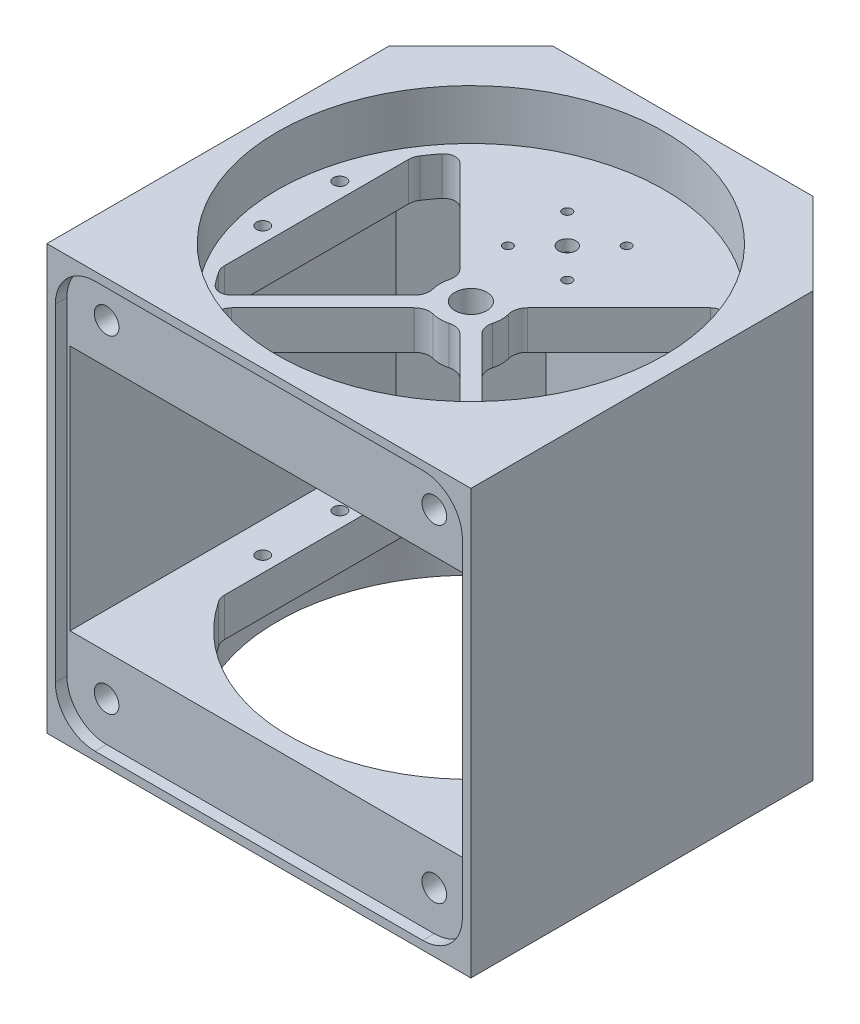
from build123d import *

# Parameters (mm, degrees)
BOSS_EXTRUDE1_DEPTH  = 3
BOSS_EXTRUDE2_REACH  = 125.02
SKETCH3_R            = 50.2
BOSS_EXTRUDE3_DEPTH  = 3
SKETCH4_R            = 50.2
BOSS_EXTRUDE5_DEPTH  = 10
SKETCH5_R            = 47.199999999999996
BOSS_EXTRUDE6_DEPTH  = 2
BOSS_EXTRUDE14_DEPTH = 20
SKETCH12_R           = 47.2
BOSS_EXTRUDE16_DEPTH = 8
SKETCH13_R           = 3.2000000000000037
CUT_EXTRUDE2_DEPTH   = 15
SKETCH14_R           = 4.15
BOSS_EXTRUDE17_DEPTH = 10
FILLET1_R            = 3
FILLET2_R            = 4
SKETCH15_R           = 1.6500000000000017
BOSS_EXTRUDE18_DEPTH = 10
FILLET3_R            = 4
FILLET4_R            = 3
FILLET5_R            = 4
FILLET6_R            = 4
BOSS_EXTRUDE19_DEPTH = 5
SKETCH17_R           = 2.2500000000000004
SKETCH17_R_2         = 1.2000000000000048
SKETCH17_R_3         = 1.200000000000003
CUT_EXTRUDE3_DEPTH   = 154.58710883404248
SKETCH18_R           = 8.2
CUT_EXTRUDE4_DEPTH   = 2
CUT_EXTRUDE5_DEPTH   = 10


with BuildPart() as part:
    # Sketch1 → Boss-Extrude1 (new body)
    with BuildSketch(Plane.XY):
        Polygon((54.99999999999996, 55), (-55.00000000000002, 54.99999999999997), (-55.00000000000001, -55.00000000000003), (54.99999999999999, -55), align=None)
        with BuildLine():
            Line((52.79999999999999, -42.500000000000014), (52.800000000000004, 42.49999999999998))
            ThreePointArc((52.800000000000004, 42.49999999999998), (49.78319984622145, 49.78319984622142), (42.50000000000001, 52.79999999999998))
            Line((42.50000000000001, 52.79999999999998), (-42.499999999999986, 52.79999999999999))
            ThreePointArc((-42.499999999999986, 52.79999999999999), (-49.78319984622143, 49.78319984622143), (-52.79999999999999, 42.499999999999986))
            Line((-52.79999999999999, 42.499999999999986), (-52.800000000000004, -42.5))
            ThreePointArc((-52.800000000000004, -42.5), (-49.78319984622144, -49.783199846221436), (-42.5, -52.8))
            Line((-42.5, -52.8), (42.499999999999986, -52.80000000000001))
            ThreePointArc((42.499999999999986, -52.80000000000001), (49.78319984622143, -49.78319984622145), (52.79999999999999, -42.500000000000014))
        make_face(mode=Mode.SUBTRACT)
    extrude(amount=-BOSS_EXTRUDE1_DEPTH)

    # Boss-Extrude2: up to this face of the body (flat: up to its plane)
    boss_extrude2_end = Plane(part.part.faces().sort_by_distance((0, 55, -1.5))[0])
    # Sketch2 → Boss-Extrude2 (add, up to the picked face)
    with BuildSketch(Plane.XZ.offset(55.000000000000014), mode=Mode.PRIVATE) as boss_extrude2_sk1:
        Polygon((54.99999999999998, -3), (54.99999999999999, -88.78679656440359), (33.786796564403566, -110), (-33.78679656440356, -110), (-55.00000000000002, -88.78679656440362), (-55.00000000000002, -3), (-52.00000000000002, -3.0000000000000027), (-52.00000000000002, -87.54415587728425), (-32.54415587728427, -107), (32.5441558772843, -107), (51.99999999999998, -87.54415587728431), (51.99999999999998, -3), align=None)
    boss_extrude2_tool1 = split(extrude(boss_extrude2_sk1.sketch, amount=-BOSS_EXTRUDE2_REACH, mode=Mode.PRIVATE), bisect_by=boss_extrude2_end, keep=Keep.BOTH, mode=Mode.PRIVATE)
    add(boss_extrude2_tool1.solids().sort_by(Axis((53.465432, -55, -45.893398), (-2.5e-16, 1, 0)))[0])

    # Sketch3 → Boss-Extrude3 (add)
    with BuildSketch(Plane.XZ.offset(55.000000000000014)):
        Polygon((-52.00000000000002, -3.0000000000000027), (-52.00000000000002, -87.54415587728425), (-32.54415587728427, -107), (32.5441558772843, -107), (51.99999999999998, -87.54415587728431), (51.99999999999998, -3), align=None)
        with Locations((0, -55)):
            Circle(SKETCH3_R, mode=Mode.SUBTRACT)
    boss_extrude3 = extrude(amount=-BOSS_EXTRUDE3_DEPTH)

    # Sketch4 → Boss-Extrude5 (add)
    with BuildSketch(Plane(origin=(1.388e-14, -52.000000000000014, 0), x_dir=(1, 2.7e-16, 0), z_dir=(-2.7e-16, 1, 0))):
        with BuildLine():
            Line((11.235657524150534, 3.000000000000002), (-11.235657524150536, 3.0000000000000027))
            ThreePointArc((-11.235657524150536, 3.0000000000000027), (1.431e-14, 108.2), (11.235657524150534, 3.000000000000002))
        make_face()
        with Locations((-7.6e-16, 55)):
            Circle(SKETCH4_R, mode=Mode.SUBTRACT)
    boss_extrude5 = extrude(amount=BOSS_EXTRUDE5_DEPTH)

    # Sketch5 → Boss-Extrude6 (add)
    with BuildSketch(Plane(origin=(1.121e-14, -42.00000000000001, 0), x_dir=(1, 2.7e-16, 0), z_dir=(-2.7e-16, 1, 0))):
        with BuildLine():
            Line((51.99999999999997, 43.76434247584933), (51.99999999999997, 66.23565752415067))
            ThreePointArc((51.99999999999997, 66.23565752415067), (37.61808075912428, 92.61808075912438), (11.235657524150533, 107.00000000000001))
            Line((11.235657524150533, 107.00000000000001), (-11.235657524150534, 107))
            ThreePointArc((-11.235657524150534, 107), (-37.618080759124375, 92.61808075912428), (-52.00000000000003, 66.23565752415041))
            Line((-52.00000000000003, 66.23565752415041), (-52.00000000000003, 43.7643424758496))
            ThreePointArc((-52.00000000000003, 43.7643424758496), (-37.618080759124375, 17.381919240875717), (-11.235657524150529, 2.9999999999999956))
            Line((-11.235657524150529, 2.9999999999999956), (11.23565752415051, 2.9999999999999956))
            ThreePointArc((11.23565752415051, 2.9999999999999956), (37.618080759124275, 17.38191924087561), (51.99999999999997, 43.76434247584933))
        make_face()
        with Locations(Location((-7.6e-16, 55, 0), (0, 0, 180))):
            Circle(SKETCH5_R, mode=Mode.SUBTRACT)
    boss_extrude6 = extrude(amount=BOSS_EXTRUDE6_DEPTH)

    # Sketch11 → Boss-Extrude14 (add)
    with BuildSketch(Plane(origin=(1.388e-14, -52.000000000000014, 0), x_dir=(1, 2.7e-16, 0), z_dir=(-2.7e-16, 1, 0))):
        with BuildLine():
            Line((-52.00000000000002, 43.76434247584956), (-52.00000000000002, 3.0000000000000027))
            Line((-52.00000000000002, 3.0000000000000027), (-46.47994974842644, 3.000000000000002))
            Line((-46.47994974842644, 3.000000000000002), (-11.235657524150511, 3.0000000000000018))
            ThreePointArc((-11.235657524150511, 3.0000000000000018), (-37.61808075912436, 17.381919240875703), (-52.00000000000002, 43.76434247584956))
        make_face()
        with BuildLine():
            Line((-11.235657524150536, 107), (-32.54415587728427, 107))
            Line((-32.54415587728427, 107), (-52.00000000000003, 87.54415587728425))
            Line((-52.00000000000003, 87.54415587728425), (-52.00000000000002, 66.23565752415044))
            ThreePointArc((-52.00000000000002, 66.23565752415044), (-37.61808075912436, 92.6180807591243), (-11.235657524150536, 107))
        make_face()
        with BuildLine():
            Line((51.99999999999998, 66.23565752415062), (51.99999999999998, 87.54415587728431))
            Line((51.99999999999998, 87.54415587728431), (32.5441558772843, 107))
            Line((32.5441558772843, 107), (11.235657524150536, 107))
            ThreePointArc((11.235657524150536, 107), (37.6180807591243, 92.61808075912435), (51.99999999999998, 66.23565752415062))
        make_face()
        with BuildLine():
            Line((11.235657524150534, 3.000000000000002), (46.47994974842649, 3.0000000000000004))
            Line((46.47994974842649, 3.0000000000000004), (51.99999999999998, 3))
            Line((51.99999999999998, 3), (51.99999999999998, 43.764342475849375))
            ThreePointArc((51.99999999999998, 43.764342475849375), (37.6180807591243, 17.38191924087564), (11.235657524150534, 3.000000000000002))
        make_face()
    boss_extrude14 = extrude(amount=BOSS_EXTRUDE14_DEPTH)

    # Sketch12 → Boss-Extrude16 (add)
    with BuildSketch(Plane(origin=(1.068e-14, -40.00000000000001, 0), x_dir=(1, 2.7e-16, 0), z_dir=(-2.7e-16, 1, 0))):
        with BuildLine():
            Line((51.99999999999997, 43.764342475849375), (51.99999999999997, 66.23565752415062))
            ThreePointArc((51.99999999999997, 66.23565752415062), (37.618080759124304, 92.61808075912435), (11.23565752415058, 106.99999999999999))
            Line((11.23565752415058, 106.99999999999999), (-11.235657524150536, 107))
            ThreePointArc((-11.235657524150536, 107), (-37.61808075912436, 92.6180807591243), (-52.00000000000003, 66.23565752415044))
            Line((-52.00000000000003, 66.23565752415044), (-52.00000000000003, 43.76434247584956))
            ThreePointArc((-52.00000000000003, 43.76434247584956), (-37.61808075912437, 17.381919240875696), (-11.235657524150529, 2.999999999999989))
            Line((-11.235657524150529, 2.999999999999989), (11.235657524150508, 3.0000000000000027))
            ThreePointArc((11.235657524150508, 3.0000000000000027), (37.61808075912429, 17.38191924087564), (51.99999999999997, 43.764342475849375))
        make_face()
        with Locations(Location((-7.6e-16, 55, 0), (0, 0, 180))):
            Circle(SKETCH12_R, mode=Mode.SUBTRACT)
    boss_extrude16 = extrude(amount=BOSS_EXTRUDE16_DEPTH)

    # Mirror2: Boss-Extrude3, Boss-Extrude5, Boss-Extrude6, Boss-Extrude14, Boss-Extrude16 across plane
    add(boss_extrude3.mirror(Plane.ZX))
    add(boss_extrude5.mirror(Plane.ZX))
    add(boss_extrude6.mirror(Plane.ZX))
    add(boss_extrude14.mirror(Plane.ZX))
    add(boss_extrude16.mirror(Plane.ZX))

    # Sketch13 → Cut-Extrude2 (cut)
    with BuildSketch(Plane.XY.offset(-3.000000000000048)):
        with Locations((-42.499999999999986, 42.5)):
            Circle(SKETCH13_R)
        with Locations((-42.499999999999986, -42.499999999999986)):
            Circle(SKETCH13_R)
        with Locations((42.49999999999999, -42.5)):
            Circle(SKETCH13_R)
        with Locations((42.50000000000001, 42.499999999999986)):
            Circle(SKETCH13_R)
    extrude(amount=-CUT_EXTRUDE2_DEPTH, mode=Mode.SUBTRACT)

    # Sketch14 → Boss-Extrude17 (add)
    with BuildSketch(Plane(origin=(1.121e-14, 42.00000000000001, 0), x_dir=(1, -2.7e-16, 0), z_dir=(2.7e-16, 1, 0))):
        with BuildLine():
            Line((-34.759678021576725, 86.93125089683014), (-6.891439137424786, 59.06301201267851))
            ThreePointArc((-6.891439137424786, 59.06301201267851), (-7.999999999999999, 54.99999999999995), (-6.891439137424732, 50.936987987321395))
            Line((-6.891439137424732, 50.936987987321395), (-34.759678021576356, 23.06874910316946))
            ThreePointArc((-34.759678021576356, 23.06874910316946), (-33.37544007200486, 21.62455992799478), (-31.93125089683014, 20.240321978423275))
            Line((-31.93125089683014, 20.240321978423275), (-4.063012012678523, 48.108560862575224))
            ThreePointArc((-4.063012012678523, 48.108560862575224), (3.881e-14, 47.00000000000001), (4.06301201267859, 48.10856086257526))
            Line((4.06301201267859, 48.10856086257526), (31.93125089683052, 20.24032197842364))
            ThreePointArc((31.93125089683052, 20.24032197842364), (33.37544007200523, 21.624559927995165), (34.75967802157674, 23.068749103169893))
            Line((34.75967802157674, 23.068749103169893), (6.8914391374247845, 50.936987987321494))
            ThreePointArc((6.8914391374247845, 50.936987987321494), (7.999999999999994, 55.00000000000005), (6.891439137424739, 59.06301201267859))
            Line((6.891439137424739, 59.06301201267859), (34.75967802157636, 86.9312508968305))
            ThreePointArc((34.75967802157636, 86.9312508968305), (33.375440072004835, 88.3754400720052), (31.93125089683011, 89.75967802157672))
            Line((31.93125089683011, 89.75967802157672), (4.063012012678516, 61.89143913742478))
            ThreePointArc((4.063012012678516, 61.89143913742478), (-4.645e-14, 63), (-4.063012012678599, 61.89143913742474))
            Line((-4.063012012678599, 61.89143913742474), (-31.931250896830555, 89.75967802157635))
            ThreePointArc((-31.931250896830555, 89.75967802157635), (-33.375440072005254, 88.37544007200484), (-34.759678021576725, 86.93125089683014))
        make_face()
        with Locations(Location((-7.6e-16, 55, 0), (0, 0, 180))):
            Circle(SKETCH14_R, mode=Mode.SUBTRACT)
    boss_extrude17 = extrude(amount=-BOSS_EXTRUDE17_DEPTH)

    # Fillet1
    # the kernel refuses this fillet: 3 mm, written as the material it adds along each edge
    with BuildSketch(Plane(origin=(-34.759678021576704, 40.000000000000014, -86.93125089683014), x_dir=(-0.6499532804124343, 0, 0.7599741661932433), z_dir=(-2.7e-16, -1, 0))) as fillet1_piece_1:
        with BuildLine():
            CenterArc((3.2430714913870022, -2.998110927308941), FILLET1_R, 87.96659386431453, 96.49532662607197)
            Line((0.25216371595927567, -3.2315004705321977), (0, 0))
            ThreePointArc((0, 0), (1.6747590196221822, 0.02972141033939397), (3.349518039244354, 5e-17))
        make_face()
    extrude(amount=8)
    with BuildSketch(Plane(origin=(-31.931250896830544, 40.000000000000014, -89.75967802157635), x_dir=(0.7599741661932361, 0, -0.6499532804124429), z_dir=(-2.7e-16, -1, 0))) as fillet1_piece_2:
        with BuildLine():
            CenterArc((3.243071491387006, 2.998110927308935), FILLET1_R, 175.53807950961286, 96.49532662607254)
            Line((0.2521637159592789, 3.2315004705322257), (0, 0))
            ThreePointArc((0, 0), (1.674759019622179, -0.02972141033938742), (3.349518039244354, -3e-17))
        make_face()
    extrude(amount=8)
    with BuildSketch(Plane(origin=(31.931250896830118, 40, -89.75967802157672), x_dir=(-0.7599741661932423, 0, -0.6499532804124355), z_dir=(-2.7e-16, -1, 0))) as fillet1_piece_3:
        with BuildLine():
            CenterArc((3.243071491386964, -2.9981109273089364), FILLET1_R, 87.96659386431435, 96.49532662607214)
            Line((0.25216371595923237, -3.2315004705321937), (0, 0))
            ThreePointArc((0, 0), (1.6747590196221533, 0.02972141033940673), (3.3495180392443262, 4e-17))
        make_face()
    extrude(amount=8)
    with BuildSketch(Plane(origin=(34.75967802157638, 40, -86.9312508968305), x_dir=(0.6499532804124455, 0, 0.7599741661932338), z_dir=(-2.7e-16, -1, 0))) as fillet1_piece_4:
        with BuildLine():
            CenterArc((3.243071491386969, 2.9981109273089324), FILLET1_R, 175.53807950961357, 96.49532662607226)
            Line((0.25216371595924175, 3.2315004705321857), (0, 0))
            ThreePointArc((0, 0), (1.6747590196221902, -0.02972141033940014), (3.34951803924434, 1.2e-16))
        make_face()
    extrude(amount=8)
    with BuildSketch(Plane(origin=(34.75967802157676, 40, -23.068749103169893), x_dir=(0.6499532804124305, 0, -0.7599741661932468), z_dir=(-2.7e-16, -1, 0))) as fillet1_piece_5:
        with BuildLine():
            CenterArc((3.243071491386989, -2.9981109273089372), FILLET1_R, 87.96659386431473, 96.49532662607226)
            Line((0.25216371595926346, -3.2315004705322194), (0, 0))
            ThreePointArc((0, 0), (1.6747590196221576, 0.02972141033939562), (3.3495180392443307, 7e-17))
        make_face()
    extrude(amount=8)
    with BuildSketch(Plane(origin=(31.93125089683053, 40, -20.240321978423637), x_dir=(-0.7599741661932353, 0, 0.6499532804124437), z_dir=(-2.7e-16, -1, 0))) as fillet1_piece_6:
        with BuildLine():
            CenterArc((3.2430714913869796, 2.9981109273089372), FILLET1_R, 175.5380795096136, 96.49532662607197)
            Line((0.2521637159592498, 3.2315004705321897), (0, 0))
            ThreePointArc((0, 0), (1.6747590196221802, -0.02972141033940335), (3.349518039244338, -4e-17))
        make_face()
    extrude(amount=8)
    with BuildSketch(Plane(origin=(-31.931250896830132, 40.000000000000014, -20.24032197842327), x_dir=(0.7599741661932465, 0, 0.6499532804124305), z_dir=(-2.7e-16, -1, 0))) as fillet1_piece_7:
        with BuildLine():
            CenterArc((3.2430714913869956, -2.998110927308939), FILLET1_R, 87.96659386431477, 96.49532662607203)
            Line((0.2521637159592676, -3.2315004705322137), (0, 0))
            ThreePointArc((0, 0), (1.6747590196221702, 0.02972141033938877), (3.349518039244335, 1e-17))
        make_face()
    extrude(amount=8)
    with BuildSketch(Plane(origin=(-34.75967802157635, 40.000000000000014, -23.06874910316946), x_dir=(-0.6499532804124424, 0, -0.7599741661932364), z_dir=(-2.7e-16, -1, 0))) as fillet1_piece_8:
        with BuildLine():
            CenterArc((3.24307149138697, 2.9981109273089377), FILLET1_R, 175.53807950961334, 96.49532662607214)
            Line((0.2521637159592439, 3.231500470532203), (0, 0))
            ThreePointArc((0, 0), (1.6747590196221709, -0.02972141033939545), (3.3495180392443236, 3.3e-16))
        make_face()
    extrude(amount=8)
    with BuildSketch(Plane(origin=(-34.75967802157635, 42.000000000000014, -23.06874910316946), x_dir=(-0.64995328041244, 0, -0.7599741661932384), z_dir=(-2.7e-16, -1, 0))) as fillet1_piece_9:
        with BuildLine():
            CenterArc((3.24307149138698, 2.9981109273089377), FILLET1_R, 175.53807950961317, 96.49532662607214)
            Line((0.2521637159592546, 3.2315004705322123), (0, 0))
            ThreePointArc((0, 0), (1.674759019622166, -0.02972141033939515), (3.3495180392443245, -1e-16))
        make_face()
    extrude(amount=2)
    with BuildSketch(Plane(origin=(-31.931250896830132, 42.000000000000014, -20.24032197842327), x_dir=(0.7599741661932475, 0, 0.6499532804124295), z_dir=(-2.7e-16, -1, 0))) as fillet1_piece_10:
        with BuildLine():
            CenterArc((3.2430714913870027, -2.9981109273089372), FILLET1_R, 87.9665938643148, 96.49532662607226)
            Line((0.2521637159592757, -3.2315004705322257), (0, 0))
            ThreePointArc((0, 0), (1.6747590196221758, 0.02972141033938655), (3.349518039244341, 1.9e-16))
        make_face()
    extrude(amount=2)
    with BuildSketch(Plane(origin=(31.93125089683053, 42, -20.240321978423637), x_dir=(-0.7599741661932368, 0, 0.6499532804124419), z_dir=(-2.7e-16, -1, 0))) as fillet1_piece_11:
        with BuildLine():
            CenterArc((3.2430714913869845, 2.9981109273089372), FILLET1_R, 175.5380795096133, 96.49532662607214)
            Line((0.2521637159592583, 3.2315004705322043), (0, 0))
            ThreePointArc((0, 0), (1.6747590196221782, -0.02972141033939944), (3.3495180392443364, 0))
        make_face()
    extrude(amount=2)
    with BuildSketch(Plane(origin=(34.75967802157676, 42, -23.068749103169893), x_dir=(0.6499532804124286, 0, -0.7599741661932481), z_dir=(-2.7e-16, -1, 0))) as fillet1_piece_12:
        with BuildLine():
            CenterArc((3.243071491386993, -2.998110927308937), FILLET1_R, 87.96659386431486, 96.4953266260722)
            Line((0.2521637159592663, -3.2315004705322234), (0, 0))
            ThreePointArc((0, 0), (1.6747590196221551, 0.02972141033939168), (3.349518039244328, 1.2e-16))
        make_face()
    extrude(amount=2)
    with BuildSketch(Plane(origin=(34.75967802157638, 42, -86.9312508968305), x_dir=(0.6499532804124443, 0, 0.7599741661932348), z_dir=(-2.7e-16, -1, 0))) as fillet1_piece_13:
        with BuildLine():
            CenterArc((3.243071491386969, 2.998110927308933), FILLET1_R, 175.53807950961348, 96.49532662607226)
            Line((0.2521637159592423, 3.23150047053219), (0, 0))
            ThreePointArc((0, 0), (1.6747590196221855, -0.02972141033939746), (3.3495180392443356, 1.2e-16))
        make_face()
    extrude(amount=2)
    with BuildSketch(Plane(origin=(31.931250896830118, 42, -89.75967802157672), x_dir=(-0.7599741661932428, 0, -0.649953280412435), z_dir=(-2.7e-16, -1, 0))) as fillet1_piece_14:
        with BuildLine():
            CenterArc((3.2430714913869685, -2.998110927308937), FILLET1_R, 87.96659386431438, 96.49532662607226)
            Line((0.2521637159592425, -3.231500470532201), (0, 0))
            ThreePointArc((0, 0), (1.674759019622156, 0.02972141033940544), (3.349518039244329, -1.1e-16))
        make_face()
    extrude(amount=2)
    with BuildSketch(Plane(origin=(-31.931250896830544, 42.000000000000014, -89.75967802157635), x_dir=(0.759974166193239, 0, -0.6499532804124394), z_dir=(-2.7e-16, -1, 0))) as fillet1_piece_15:
        with BuildLine():
            CenterArc((3.243071491387015, 2.998110927308935), FILLET1_R, 175.53807950961294, 96.4953266260722)
            Line((0.252163715959291, 3.231500470532222), (0, 0))
            ThreePointArc((0, 0), (1.6747590196221724, -0.02972141033938204), (3.3495180392443498, 5e-17))
        make_face()
    extrude(amount=2)
    with BuildSketch(Plane(origin=(-34.759678021576704, 42.000000000000014, -86.93125089683014), x_dir=(-0.649953280412433, 0, 0.7599741661932444), z_dir=(-2.7e-16, -1, 0))) as fillet1_piece_16:
        with BuildLine():
            CenterArc((3.2430714913870027, -2.9981109273089412), FILLET1_R, 87.96659386431465, 96.49532662607191)
            Line((0.25216371595927617, -3.231500470532203), (0, 0))
            ThreePointArc((0, 0), (1.674759019622182, 0.02972141033939672), (3.3495180392443498, 5e-17))
        make_face()
    extrude(amount=2)

    # Fillet2
    fillet2_edges = [part.edges().sort_by_distance(p)[0] for p in [
        (-4.0630120126785885, 37.00000000000001, -61.89143913742474),
        (4.063012012678526, 37.00000000000001, -61.89143913742478),
        (6.89143913742475, 37.00000000000001, -59.06301201267859),
        (6.891439137424796, 37.00000000000001, -50.936987987321494),
        (4.0630120126786, 37.00000000000001, -48.10856086257526),
        (-4.063012012678513, 37.00000000000001, -48.108560862575224),
        (-6.891439137424723, 37.00000000000001, -50.936987987321395),
        (-6.8914391374247765, 37.00000000000001, -59.06301201267851),
    ]]
    fillet(fillet2_edges, radius=FILLET2_R)

    # Sketch15 → Boss-Extrude18 (add)
    # profile 1 of 2: a face of its own
    with BuildSketch(Plane(origin=(1.121e-14, 42.00000000000001, 0), x_dir=(1, -2.7e-16, 0), z_dir=(2.7e-16, 1, 0))):
        with BuildLine():
            Line((-40.00000000000001, 80.05673562138533), (-40.00000000000001, 29.943264378614696))
            ThreePointArc((-40.00000000000001, 29.943264378614696), (-47.20000000000001, 55.00000000000003), (-40.00000000000001, 80.05673562138533))
        make_face()
        with Locations(Location((-44.000000000000014, 65, 0), (0, 0, 180))):
            Circle(SKETCH15_R, mode=Mode.SUBTRACT)
        with Locations(Location((-44.000000000000014, 44.99999999999999, 0), (0, 0, 180))):
            Circle(SKETCH15_R, mode=Mode.SUBTRACT)
    # profile 2 of 2: a face of its own
    with BuildSketch(Plane(origin=(1.121e-14, 42.00000000000001, 0), x_dir=(1, -2.7e-16, 0), z_dir=(2.7e-16, 1, 0))):
        with BuildLine():
            Line((40.00000000000001, 80.05673562138533), (40.00000000000001, 29.943264378614696))
            ThreePointArc((40.00000000000001, 29.943264378614696), (47.199999999999996, 55.00000000000001), (40.00000000000001, 80.05673562138533))
        make_face()
        with Locations(Location((43.999999999999986, 45.00000000000001, 0), (0, 0, 180))):
            Circle(SKETCH15_R, mode=Mode.SUBTRACT)
        with Locations(Location((43.999999999999986, 64.99999999999999, 0), (0, 0, 180))):
            Circle(SKETCH15_R, mode=Mode.SUBTRACT)
    boss_extrude18 = extrude(amount=-BOSS_EXTRUDE18_DEPTH)

    # Fillet3
    fillet3_edges = [part.edges().sort_by_distance(p)[0] for p in [
        (-39.999999999999986, 37.00000000000002, -29.9432643786147),
        (-39.999999999999986, 37.00000000000002, -80.05673562138533),
        (40.00000000000003, 36.99999999999999, -80.05673562138533),
        (40.00000000000003, 36.99999999999999, -29.943264378614693),
    ]]
    fillet(fillet3_edges, radius=FILLET3_R)

    # Mirror8: Boss-Extrude17 across plane
    add(boss_extrude17.mirror(Plane.ZX))

    # Fillet4
    # the kernel refuses this fillet: 3 mm, written as the material it adds along each edge
    with BuildSketch(Plane(origin=(-31.931250896830544, -42.000000000000014, -89.75967802157635), x_dir=(0.7071067811865519, 0, 0.7071067811865431), z_dir=(-2.7e-16, 1, 0))) as fillet4_piece_1:
        with BuildLine():
            CenterArc((3.2413240860327965, 3.0000000000000018), FILLET4_R, 173.5046733739275, 96.4953266260726)
            ThreePointArc((0.26058082839913094, 3.339366515837124), (0.10065908177263826, 1.671995480046251), (0, 0))
            Line((0, 0), (3.2413240860328005, -4e-17))
        make_face()
    extrude(amount=10)
    with BuildSketch(Plane(origin=(-34.759678021576704, -42.000000000000014, -86.93125089683014), x_dir=(0.7071067811865498, 0, 0.7071067811865454), z_dir=(-2.7e-16, 1, 0))) as fillet4_piece_2:
        with BuildLine():
            CenterArc((3.2413240860327814, -3.0000000000000044), FILLET4_R, 90.0000000000002, 96.49532662607226)
            ThreePointArc((0.2605808283991172, -3.339366515837124), (0.10065908177263523, -1.6719954800462546), (0, 0))
            Line((0, 0), (3.241324086032771, -3e-17))
        make_face()
    extrude(amount=10)
    with BuildSketch(Plane(origin=(-34.75967802157635, -42.000000000000014, -23.06874910316946), x_dir=(0.7071067811865437, 0, -0.7071067811865513), z_dir=(-2.7e-16, 1, 0))) as fillet4_piece_3:
        with BuildLine():
            CenterArc((3.241324086032779, 2.999999999999999), FILLET4_R, 173.50467337392803, 96.49532662607191)
            ThreePointArc((0.26058082839910807, 3.3393665158370944), (0.10065908177262935, 1.6719954800462438), (0, 0))
            Line((0, 0), (3.241324086032778, 7e-17))
        make_face()
    extrude(amount=10)
    with BuildSketch(Plane(origin=(-31.931250896830132, -42.000000000000014, -20.24032197842327), x_dir=(0.7071067811865437, 0, -0.7071067811865513), z_dir=(-2.7e-16, 1, 0))) as fillet4_piece_4:
        with BuildLine():
            CenterArc((3.2413240860327943, -3.0000000000000018), FILLET4_R, 90.00000000000003, 96.49532662607203)
            ThreePointArc((0.2605808283991248, -3.3393665158370998), (0.10065908177263895, -1.6719954800462373), (0, 0))
            Line((0, 0), (3.241324086032793, 5e-17))
        make_face()
    extrude(amount=10)
    with BuildSketch(Plane(origin=(31.93125089683053, -42, -20.240321978423637), x_dir=(-0.7071067811865508, 0, -0.7071067811865442), z_dir=(-2.7e-16, 1, 0))) as fillet4_piece_5:
        with BuildLine():
            CenterArc((3.241324086032764, 2.999999999999999), FILLET4_R, 173.50467337392772, 96.49532662607231)
            ThreePointArc((0.26058082839909547, 3.3393665158371095), (0.10065908177261798, 1.6719954800462538), (0, 0))
            Line((0, 0), (3.2413240860327655, 4e-17))
        make_face()
    extrude(amount=10)
    with BuildSketch(Plane(origin=(34.75967802157676, -42, -23.068749103169893), x_dir=(-0.7071067811865536, 0, -0.7071067811865415), z_dir=(-2.7e-16, 1, 0))) as fillet4_piece_6:
        with BuildLine():
            CenterArc((3.241324086032785, -3.0000000000000018), FILLET4_R, 89.99999999999984, 96.4953266260722)
            ThreePointArc((0.26058082839911434, -3.3393665158371006), (0.10065908177263108, -1.67199548004623), (0, 0))
            Line((0, 0), (3.241324086032793, -9e-17))
        make_face()
    extrude(amount=10)
    with BuildSketch(Plane(origin=(34.75967802157638, -42, -86.9312508968305), x_dir=(-0.7071067811865432, 0, 0.707106781186552), z_dir=(-2.7e-16, 1, 0))) as fillet4_piece_7:
        with BuildLine():
            CenterArc((3.2413240860327646, 2.9999999999999996), FILLET4_R, 173.50467337392766, 96.49532662607226)
            ThreePointArc((0.2605808283990983, 3.339366515837112), (0.10065908177262066, 1.671995480046264), (0, 0))
            Line((0, 0), (3.241324086032761, -5e-17))
        make_face()
    extrude(amount=10)
    with BuildSketch(Plane(origin=(31.931250896830118, -42, -89.75967802157672), x_dir=(-0.7071067811865415, 0, 0.7071067811865536), z_dir=(-2.7e-16, 1, 0))) as fillet4_piece_8:
        with BuildLine():
            CenterArc((3.241324086032765, -3.0000000000000018), FILLET4_R, 89.99999999999984, 96.49532662607214)
            ThreePointArc((0.2605808283990917, -3.339366515837098), (0.10065908177260852, -1.6719954800462276), (0, 0))
            Line((0, 0), (3.241324086032773, -7e-17))
        make_face()
    extrude(amount=10)

    # Fillet5
    fillet5_edges = [part.edges().sort_by_distance(p)[0] for p in [
        (-6.8914391374247765, -37.00000000000001, -59.06301201267851),
        (-6.891439137424723, -37.00000000000001, -50.936987987321395),
        (-4.063012012678513, -37.00000000000001, -48.108560862575224),
        (4.0630120126786, -37.00000000000001, -48.10856086257526),
        (6.891439137424796, -37.00000000000001, -50.936987987321494),
        (6.89143913742475, -37.00000000000001, -59.06301201267859),
        (4.063012012678526, -37.00000000000001, -61.89143913742478),
        (-4.0630120126785885, -37.00000000000001, -61.89143913742474),
    ]]
    fillet(fillet5_edges, radius=FILLET5_R)

    # Mirror9: Boss-Extrude18 across plane
    add(boss_extrude18.mirror(Plane.ZX))

    # Fillet6
    fillet6_edges = [part.edges().sort_by_distance(p)[0] for p in [
        (-39.999999999999986, -37.00000000000002, -80.05673562138533),
        (-39.999999999999986, -37.00000000000002, -29.9432643786147),
        (40.00000000000003, -36.99999999999999, -29.943264378614693),
        (40.00000000000003, -36.99999999999999, -80.05673562138533),
    ]]
    fillet(fillet6_edges, radius=FILLET6_R)

    # Sketch16 → Boss-Extrude19 (add)
    with BuildSketch(Plane(origin=(1.121e-14, 42.00000000000001, 0), x_dir=(1, -2.7e-16, 0), z_dir=(2.7e-16, 1, 0))):
        with BuildLine():
            Line((29.63928865557307, 87.46771578031965), (5.934255665976376, 63.76268279072267))
            ThreePointArc((5.934255665976376, 63.76268279072267), (4.141104721640273, 62.72740661031258), (2.0705523608201073, 62.72740661031256))
            ThreePointArc((2.0705523608201073, 62.72740661031256), (-5.001e-14, 63), (-2.070552360820204, 62.727406610312535))
            ThreePointArc((-2.070552360820204, 62.727406610312535), (-4.141104721640372, 62.72740661031253), (-5.934255665976486, 63.7626827907226))
            Line((-5.934255665976486, 63.7626827907226), (-29.63928865557346, 87.46771578031928))
            ThreePointArc((-29.63928865557346, 87.46771578031928), (-30.51315025748068, 89.75899233456124), (-29.38570371780663, 91.93670825898384))
            ThreePointArc((-29.38570371780663, 91.93670825898384), (-2.9132e-13, 102.19999999999999), (29.385703717806177, 91.9367082589842))
            ThreePointArc((29.385703717806177, 91.9367082589842), (30.51315025748025, 89.75899233456163), (29.63928865557307, 87.46771578031965))
        make_face()
    extrude(amount=-BOSS_EXTRUDE19_DEPTH)

    # Sketch17 → Cut-Extrude3 (cut, through all)
    with BuildSketch(Plane.XZ.offset(-37.000000000000014)):
        with Locations((3.06e-15, -80)):
            Circle(SKETCH17_R)
        with Locations((7.699999999999999, -72.3)):
            Circle(SKETCH17_R_2)
        with Locations((7.700000000000001, -87.7)):
            Circle(SKETCH17_R_3)
        with Locations((-7.699999999999995, -87.7)):
            Circle(SKETCH17_R_3)
        with Locations((-7.699999999999997, -72.3)):
            Circle(SKETCH17_R_3)
    extrude(amount=-CUT_EXTRUDE3_DEPTH, mode=Mode.SUBTRACT)

    # Sketch18 → Cut-Extrude4 (cut)
    with BuildSketch(Plane.XZ.offset(-37.000000000000014)):
        with Locations((3.06e-15, -80)):
            Circle(SKETCH18_R)
    extrude(amount=-CUT_EXTRUDE4_DEPTH, mode=Mode.SUBTRACT)

    # Sketch20 → Cut-Extrude5 (cut)
    with BuildSketch(Plane.XZ.offset(42.00000000000001)):
        with BuildLine():
            Line((40.00000000000001, -78.87969849055887), (40.00000000000001, -31.12030150944113))
            ThreePointArc((40.00000000000001, -31.12030150944113), (39.82970843102536, -29.96560097106188), (39.333333333333336, -28.909218315870863))
            ThreePointArc((39.333333333333336, -28.909218315870863), (38.17058997350532, -27.23588537203942), (36.93670825898421, -25.61429628219384))
            ThreePointArc((36.93670825898421, -25.61429628219384), (2.8824e-13, -7.80000000000021), (-36.936708258983856, -25.614296282193393))
            ThreePointArc((-36.936708258983856, -25.614296282193393), (-38.17058997350513, -27.23588537203917), (-39.33333333333332, -28.90921831587086))
            ThreePointArc((-39.33333333333332, -28.90921831587086), (-39.82970843102534, -29.965600971061868), (-40.00000000000001, -31.120301509441116))
            Line((-40.00000000000001, -31.120301509441116), (-40.00000000000001, -78.87969849055888))
            ThreePointArc((-40.00000000000001, -78.87969849055888), (-39.82970843102536, -80.03439902893813), (-39.333333333333336, -81.09078168412914))
            ThreePointArc((-39.333333333333336, -81.09078168412914), (-38.170589973505315, -82.7641146279606), (-36.9367082589842, -84.3857037178062))
            ThreePointArc((-36.9367082589842, -84.3857037178062), (-2.5162e-13, -102.19999999999987), (36.93670825898387, -84.38570371780659))
            ThreePointArc((36.93670825898387, -84.38570371780659), (38.17058997350515, -82.76411462796081), (39.333333333333336, -81.09078168412914))
            ThreePointArc((39.333333333333336, -81.09078168412914), (39.82970843102536, -80.03439902893813), (40.00000000000001, -78.87969849055887))
        make_face()
    extrude(amount=-CUT_EXTRUDE5_DEPTH, mode=Mode.SUBTRACT)


solid = part.part
